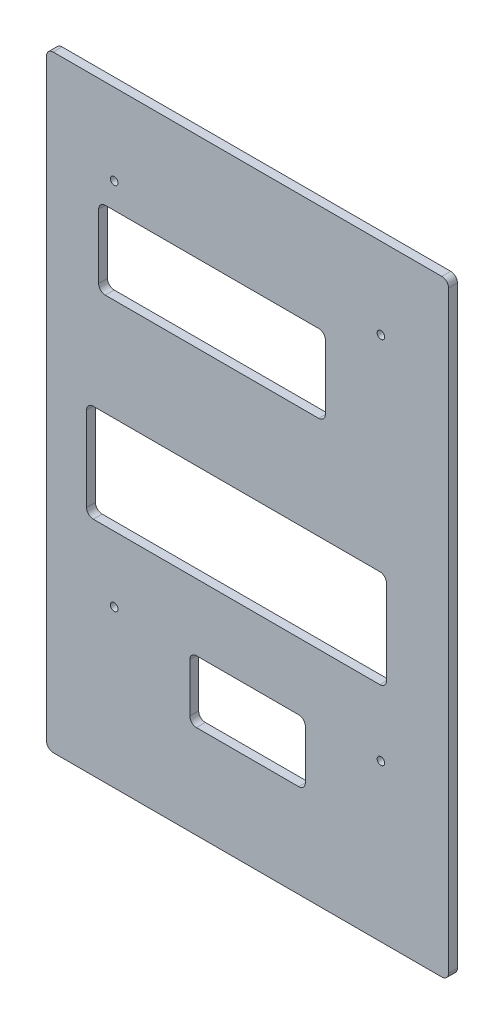
from build123d import *

# Parameters (mm, degrees)
ESQUISSE1_W             = 180.86
ESQUISSE1_H             = 273
ESQUISSE1_R             = 1.5
ESQUISSE1_W_2           = 52
ESQUISSE1_H_2           = 28
ESQUISSE1_W_3           = 134.93
ESQUISSE1_H_3           = 44
ESQUISSE1_W_4           = 102
ESQUISSE1_H_4           = 35
BOSS_EXTRU_1_DEPTH      = 4
D_GAGEMENT_M31_D        = 3.4
CONG_1_R                = 3
ESQUISSE5_R             = 2.37073369
ENL_V_MAT_EXTRU_2_DEPTH = 1


with BuildPart() as part:
    # Esquisse1 → Boss.-Extru.1 (new body)
    with BuildSketch(Plane.XY):
        with Locations((90.43, 136.5)):
            Rectangle(ESQUISSE1_W, ESQUISSE1_H)
        with Locations((30.43, 236.5)):
            Circle(ESQUISSE1_R, mode=Mode.SUBTRACT)
        with Locations((150.43, 236.5)):
            Circle(ESQUISSE1_R, mode=Mode.SUBTRACT)
        with Locations((30.43, 70.5)):
            Circle(ESQUISSE1_R, mode=Mode.SUBTRACT)
        with Locations((150.43, 70.5)):
            Circle(ESQUISSE1_R, mode=Mode.SUBTRACT)
        with Locations((90.43, 56)):
            Rectangle(ESQUISSE1_W_2, ESQUISSE1_H_2, mode=Mode.SUBTRACT)
        with Locations((85.465, 122)):
            Rectangle(ESQUISSE1_W_3, ESQUISSE1_H_3, mode=Mode.SUBTRACT)
        with Locations((74.43, 207.5)):
            Rectangle(ESQUISSE1_W_4, ESQUISSE1_H_4, mode=Mode.SUBTRACT)
    extrude(amount=BOSS_EXTRU_1_DEPTH)

    # Dégagement M31 (through all)
    with Locations(Plane.XY.offset(4)):
        with Locations((30.43, 236.5), (150.43, 236.5), (150.43, 70.5), (30.43, 70.5)):
            Hole(D_GAGEMENT_M31_D / 2)

    # Congé1
    cong_1_edges = [part.edges().sort_by_distance(p)[0] for p in [
        (0, 0, 2),
        (180.86, 0, 2),
        (116.43, 42, 2),
        (64.43, 42, 2),
        (116.43, 70, 2),
        (64.43, 70, 2),
        (152.93, 100, 2),
        (18, 100, 2),
        (152.93, 144, 2),
        (18, 144, 2),
        (180.86, 273, 2),
        (0, 273, 2),
        (125.43, 190, 2),
        (125.43, 225, 2),
        (23.43, 225, 2),
        (23.43, 190, 2),
    ]]
    fillet(cong_1_edges, radius=CONG_1_R)

    # Esquisse5 → Enlèv. mat.-Extru.2 (cut)
    # profile 1 of 11: a face of its own
    with BuildSketch(Plane(origin=(0, 0, 0), x_dir=(-1, 0, 0), z_dir=(0, 0, -1))):
        Polygon((-94.283346835, 174.034677194), (-91.185169292, 174.034677194), (-91.182359598, 166.790649968), (-88.077554099, 170.336852385), (-84.69677529, 170.336852385), (-88.331818801, 166.259366774), (-84.453541471, 160.018398975), (-87.922812939, 160.018398975), (-90.427752118, 164.343168722), (-91.182359598, 163.827233749), (-91.182359598, 160.018398975), (-94.283346835, 160.018398975), align=None)
    # profile 2 of 11: a face of its own
    with BuildSketch(Plane(origin=(0, 0, 0), x_dir=(-1, 0, 0), z_dir=(0, 0, -1))):
        with BuildLine():
            Line((-78.792459122, 174.034677194), (-75.689252185, 174.034677194))
            Line((-75.689252185, 174.034677194), (-75.689252185, 169.149539362))
            add(Edge.make_bspline(
                [(-75.689252185, 169.149539362), (-75.259442931, 169.759749882), (-73.910117231, 170.528137365), (-70.907930579, 170.723106308), (-69.542099901, 168.641576988), (-69.526370215, 167.438557264)],
                knots=[0, 0, 0, 0, 0.262740623, 0.558365338, 1, 1, 1, 1], degree=3))
            Line((-69.526370215, 167.438557264), (-69.526370215, 160.018398975))
            Line((-69.526370215, 160.018398975), (-72.624885356, 160.018398975))
            Line((-72.624885356, 160.018398975), (-72.624885356, 166.790649968))
            add(Edge.make_bspline(
                [(-75.694281579, 165.950650474), (-75.607046533, 166.608895098), (-75.198613544, 167.568039344), (-73.608769863, 168.496367369), (-72.525461974, 167.521061969), (-72.624885356, 166.790649968)],
                knots=[0, 0, 0, 0, 0.39454131, 0.596070008, 1, 1, 1, 1], degree=3))
            Line((-75.694281579, 165.950650474), (-75.694281579, 160.018398975))
            Line((-75.694281579, 160.018398975), (-78.792459122, 160.018398975))
            Line((-78.792459122, 160.018398975), (-78.792459122, 174.034677194))
        make_face()
    # profile 3 of 11: a face of its own
    with BuildSketch(Plane(origin=(0, 0, 0), x_dir=(-1, 0, 0), z_dir=(0, 0, -1))):
        with BuildLine():
            Line((-139.256891809, 172.935323872), (-137.158126377, 172.935323872))
            Line((-137.158126377, 172.935323872), (-137.158126377, 170.436793596))
            Line((-137.158126377, 170.436793596), (-133.673463028, 170.436793596))
            Line((-133.673463028, 170.436793596), (-133.673463028, 168.138145742))
            Line((-133.673463028, 168.138145742), (-137.158126377, 168.138145742))
            Line((-137.158126377, 168.138145742), (-137.158126377, 162.870364156))
            add(Edge.make_bspline(
                [(-137.158126377, 162.870364156), (-137.135735133, 162.620457218), (-136.829841883, 162.329297605), (-135.45963159, 161.948909237), (-134.22981955, 162.30663317), (-133.27943708, 162.541437923)],
                knots=[0, 0, 0, 0, 0.163675361, 0.277490049, 1, 1, 1, 1], degree=3))
            Line((-133.27943708, 162.541437923), (-133.27943708, 160.242790069))
            add(Edge.make_bspline(
                [(-133.27943708, 160.242790069), (-134.814099805, 160.050957228), (-138.701915147, 159.232331269), (-139.675674588, 161.34214339), (-139.808114513, 161.629096562), (-139.94978442, 161.926620231), (-139.975498221, 162.24161429), (-140.135507958, 164.201733563), (-140.072016369, 166.174224534), (-140.175380643, 168.138145742)],
                knots=[0, 0, 0, 0, 1, 1, 1, 2, 2, 2, 3, 3, 3, 3], degree=3))
            Line((-140.175380643, 168.138145742), (-141.753204023, 168.138145742))
            Line((-141.753204023, 168.138145742), (-141.753204023, 170.336852385))
            Line((-141.753204023, 170.336852385), (-140.023860949, 170.336852385))
            Line((-140.023860949, 170.336852385), (-139.256891809, 172.935323872))
        make_face()
    # profile 4 of 11: a face of its own
    with BuildSketch(Plane(origin=(0, 0, 0), x_dir=(-1, 0, 0), z_dir=(0, 0, -1))):
        with BuildLine():
            Line((-12.931201039, 172.935323872), (-10.932376817, 172.835382661))
            Line((-10.932376817, 172.835382661), (-10.832435606, 170.436793596))
            Line((-10.832435606, 170.436793596), (-7.434434431, 170.436793596))
            Line((-7.434434431, 170.436793596), (-7.434434431, 168.138145742))
            Line((-7.434434431, 168.138145742), (-10.932376817, 168.138145742))
            Line((-10.932376817, 168.138145742), (-10.832435606, 162.541437923))
            add(Edge.make_bspline(
                [(-7.034669586, 162.441496712), (-7.800572606, 162.237765999), (-9.055924893, 162.128236657), (-10.454489022, 162.072852708), (-10.832435606, 162.541437923)],
                knots=[0, 0, 0, 0, 0.590901675, 1, 1, 1, 1], degree=3))
            Line((-7.034669586, 162.441496712), (-7.034669586, 160.242790069))
            add(Edge.make_bspline(
                [(-7.034669586, 160.242790069), (-8.624443953, 160.067625406), (-12.469864417, 159.308373099), (-13.414156851, 161.435507228), (-13.623994546, 161.908192286), (-13.782004231, 162.4232356), (-13.791969329, 162.940307858), (-13.825996528, 164.705922314), (-13.806980244, 166.472160588), (-13.814485702, 168.238086953)],
                knots=[0, 0, 0, 0, 1, 1, 1, 2, 2, 2, 3, 3, 3, 3], degree=3))
            Line((-13.814485702, 168.238086953), (-15.440621885, 168.238086953))
            Line((-15.440621885, 168.238086953), (-15.440621885, 170.436793596))
            Line((-15.440621885, 170.436793596), (-13.716472945, 170.436793596))
            Line((-13.716472945, 170.436793596), (-12.931201039, 172.935323872))
        make_face()
    # profile 5 of 11: a face of its own
    with BuildSketch(Plane(origin=(0, 0, 0), x_dir=(-1, 0, 0), z_dir=(0, 0, -1))):
        Polygon((-174.236315677, 172.835382661), (-163.638100396, 172.835382661), (-163.638100396, 170.233513434), (-167.332675309, 170.233513434), (-167.332675309, 160.018398975), (-170.52219302, 160.018398975), (-170.570325513, 170.233513434), (-174.236315677, 170.233513434), align=None)
    # profile 6 of 11: a face of its own
    with BuildSketch(Plane(origin=(0, 0, 0), x_dir=(-1, 0, 0), z_dir=(0, 0, -1))):
        with BuildLine():
            Line((-47.213493181, 160.06614185), (-47.213493181, 172.835382661))
            Line((-47.213493181, 172.835382661), (-41.519185643, 172.835382661))
            add(Edge.make_bspline(
                [(-39.528607541, 166.790649968), (-38.956489083, 166.948005768), (-38.237437626, 167.683242131), (-37.896820407, 168.973263869), (-37.811326567, 170.127809871), (-38.284767117, 171.257641656), (-39.479973382, 172.391122107), (-40.692099064, 172.776713978), (-41.519185643, 172.835382661)],
                knots=[0, 0, 0, 0, 0.199158379, 0.317574937, 0.451003297, 0.584990763, 0.718220369, 1, 1, 1, 1], degree=3))
            add(Edge.make_bspline(
                [(-40.669958921, 160.06614185), (-39.736727743, 160.157652535), (-38.480391966, 160.846771809), (-37.259453131, 162.342559511), (-37.170137797, 163.667458124), (-37.174288807, 165.538002607), (-38.716644404, 166.479395874), (-39.528607541, 166.790649968)],
                knots=[0, 0, 0, 0, 0.282707491, 0.435580188, 0.571415841, 0.685536499, 1, 1, 1, 1], degree=3))
            Line((-40.669958921, 160.06614185), (-47.213493181, 160.06614185))
        make_face()
        with BuildLine():
            Line((-44.008657035, 167.93826332), (-44.008657035, 170.336852385))
            Line((-44.008657035, 170.336852385), (-42.174298778, 170.336852385))
            add(Edge.make_bspline(
                [(-42.049794824, 167.93826332), (-41.669827031, 167.927070476), (-41.248589309, 168.346380324), (-41.07437401, 169.11731054), (-41.21655482, 169.96394874), (-41.825514646, 170.299249739), (-42.174298778, 170.336852385)],
                knots=[0, 0, 0, 0, 0.294874779, 0.472371571, 0.685290478, 1, 1, 1, 1], degree=3))
            Line((-42.049794824, 167.93826332), (-44.008657035, 167.93826332))
        make_face(mode=Mode.SUBTRACT)
        with BuildLine():
            Line((-44.026733029, 165.464806319), (-44.026733029, 162.541437923))
            Line((-44.026733029, 162.541437923), (-41.810545792, 162.541437923))
            ThreePointArc((-41.810545792, 162.541437923), (-40.348861594, 164.003122121), (-41.810545792, 165.464806319))
            Line((-41.810545792, 165.464806319), (-44.026733029, 165.464806319))
        make_face(mode=Mode.SUBTRACT)
    # profile 7 of 11: a face of its own
    with BuildSketch(Plane(origin=(0, 0, 0), x_dir=(-1, 0, 0), z_dir=(0, 0, -1))):
        with BuildLine():
            Line((-27.522617852, 172.135794184), (-25.223969998, 172.035852973))
            Line((-25.223969998, 172.035852973), (-24.924146365, 170.636676018))
            add(Edge.make_bspline(
                [(-24.924146365, 170.636676018), (-23.547713892, 170.177865194), (-23.893594467, 170.424239717), (-22.825380933, 171.136382073)],
                knots=[0, 0, 0, 0, 1, 1, 1, 1], degree=3))
            Line((-22.825380933, 171.136382073), (-21.149702282, 169.437381485))
            Line((-21.149702282, 169.437381485), (-22.045562011, 168.238086953))
            Line((-22.045562011, 168.238086953), (-21.633263005, 167.328340687))
            Line((-21.633263005, 167.328340687), (-20.226909445, 167.138733631))
            Line((-20.226909445, 167.138733631), (-20.326850656, 164.840085777))
            Line((-20.326850656, 164.840085777), (-21.726027611, 164.540262144))
            add(Edge.make_bspline(
                [(-21.726027611, 164.540262144), (-22.206613971, 163.098503063), (-21.903336346, 163.59564387), (-21.326262767, 162.441496712)],
                knots=[0, 0, 0, 0, 1, 1, 1, 1], degree=3))
            Line((-21.326262767, 162.441496712), (-22.925322144, 160.842437335))
            Line((-22.925322144, 160.842437335), (-24.124616676, 161.641967023))
            Line((-24.124616676, 161.641967023), (-25.024087576, 161.242202179))
            Line((-25.024087576, 161.242202179), (-25.323911209, 159.843025224))
            Line((-25.323911209, 159.843025224), (-27.522617852, 159.942966435))
            Line((-27.522617852, 159.942966435), (-27.822441485, 161.34214339))
            add(Edge.make_bspline(
                [(-27.822441485, 161.34214339), (-28.799212683, 161.667733789), (-28.555204575, 161.758652056), (-29.22161844, 161.34214339), (-29.449377161, 161.19979419), (-29.688010758, 161.075633494), (-29.921206917, 160.942378546)],
                knots=[0, 0, 0, 0, 1, 1, 1, 2, 2, 2, 2], degree=3))
            Line((-29.921206917, 160.942378546), (-31.520266294, 162.541437923))
            Line((-31.520266294, 162.541437923), (-30.720736606, 163.740732455))
            Line((-30.720736606, 163.740732455), (-31.12050145, 164.640203355))
            Line((-31.12050145, 164.640203355), (-32.519678405, 164.940026988))
            Line((-32.519678405, 164.940026988), (-32.419737194, 167.138733631))
            Line((-32.419737194, 167.138733631), (-31.020560239, 167.438557264))
            Line((-31.020560239, 167.438557264), (-30.720736606, 168.338028164))
            Line((-30.720736606, 168.338028164), (-31.520266294, 169.537322696))
            Line((-31.520266294, 169.537322696), (-29.921206917, 171.036440862))
            add(Edge.make_bspline(
                [(-29.921206917, 171.036440862), (-29.494314144, 170.894143271), (-29.168603613, 170.386484744), (-28.721912385, 170.336852385), (-28.380115397, 170.298874942), (-28.120867147, 170.537200797), (-27.822441485, 170.636676018)],
                knots=[0, 0, 0, 0, 1, 1, 1, 2, 2, 2, 2], degree=3))
            Line((-27.822441485, 170.636676018), (-27.522617852, 172.135794184))
        make_face()
        with Locations((-26.386833531, 165.983241371)):
            Circle(ESQUISSE5_R, mode=Mode.SUBTRACT)
    # profile 8 of 11: a face of its own
    with BuildSketch(Plane(origin=(0, 0, 0), x_dir=(-1, 0, 0), z_dir=(0, 0, -1))):
        Polygon((-121.36741503, 171.73602934), (-113.272176935, 160.142848858), (-130.162241603, 160.242790069), align=None)
        Polygon((-122.8784515, 167.733423277), (-124.965298628, 161.242202179), (-127.96353496, 161.34214339), align=None, mode=Mode.SUBTRACT)
        Polygon((-121.267473819, 169.437381485), (-115.470883578, 161.34214339), (-123.666062884, 161.34214339), align=None, mode=Mode.SUBTRACT)
    # profile 9 of 11: a face of its own
    with BuildSketch(Plane(origin=(0, 0, 0), x_dir=(-1, 0, 0), z_dir=(0, 0, -1))):
        with BuildLine():
            Line((-101.1220469, 160.018398975), (-104.165968477, 160.018398975))
            Line((-104.165968477, 160.018398975), (-104.165968477, 165.950650474))
            add(Edge.make_bspline(
                [(-107.272446663, 165.950650474), (-107.246526147, 166.745002821), (-106.276228736, 168.588199152), (-104.043085613, 167.741682876), (-104.204058368, 166.455663269), (-104.165968477, 165.950650474)],
                knots=[0, 0, 0, 0, 0.496685, 0.694227188, 1, 1, 1, 1], degree=3))
            Line((-107.272446663, 165.950650474), (-107.272446663, 160.018398975))
            Line((-107.272446663, 160.018398975), (-110.373881815, 160.018398975))
            Line((-110.373881815, 160.018398975), (-110.373881815, 170.436793596))
            Line((-110.373881815, 170.436793596), (-107.470999641, 170.436793596))
            Line((-107.470999641, 170.436793596), (-107.470999641, 169.149539362))
            Line((-107.470999641, 169.149539362), (-107.272446663, 169.149539362))
            add(Edge.make_bspline(
                [(-107.272446663, 169.149539362), (-106.858538525, 169.829859962), (-105.517894499, 170.598013205), (-103.520232225, 170.635762217), (-101.657211683, 169.687420486), (-101.152134581, 168.286093678), (-101.1220469, 167.438557264)],
                knots=[0, 0, 0, 0, 0.278640188, 0.525252243, 0.687769466, 1, 1, 1, 1], degree=3))
            Line((-101.1220469, 167.438557264), (-101.1220469, 160.018398975))
        make_face()
    # profile 10 of 11: a face of its own
    with BuildSketch(Plane(origin=(0, 0, 0), x_dir=(-1, 0, 0), z_dir=(0, 0, -1))):
        with BuildLine():
            Line((-55.536124826, 159.942966435), (-54.05995465, 159.942966435))
            add(Edge.make_bspline(
                [(-54.05995465, 159.942966435), (-53.508105979, 160.01579836), (-53.000836715, 160.242790069)],
                knots=[0, 0, 0, 1, 1, 1], degree=2))
            Line((-53.000836715, 160.242790069), (-53.000836715, 162.127229521))
            add(Edge.make_bspline(
                [(-54.414465889, 162.65067545), (-54.397822189, 162.444945707), (-54.131217592, 161.731860695), (-53.322133646, 162.037641941), (-53.000836715, 162.127229521)],
                knots=[0, 0, 0, 0, 0.373122237, 1, 1, 1, 1], degree=3))
            Line((-54.414465889, 162.65067545), (-54.414465889, 167.006083276))
            add(Edge.make_bspline(
                [(-54.414465889, 167.006083276), (-54.386504145, 167.621449135), (-54.651940285, 168.602619281), (-55.530786964, 169.638124659), (-56.720166972, 170.506789896), (-57.883902376, 170.537080698), (-58.570212672, 170.576762938)],
                knots=[0, 0, 0, 0, 0.300061028, 0.469139707, 0.655769187, 1, 1, 1, 1], degree=3))
            add(Edge.make_bspline(
                [(-62.909353069, 167.1387297), (-62.863627032, 167.85106608), (-62.159984886, 169.942717077), (-59.815362212, 170.602349771), (-58.570212672, 170.576762938)],
                knots=[0, 0, 0, 0, 0.353066215, 1, 1, 1, 1], degree=3))
            Line((-62.909353069, 167.1387297), (-59.710062437, 167.03879242))
            add(Edge.make_bspline(
                [(-59.710062437, 167.03879242), (-59.772976556, 167.453131763), (-59.351848428, 168.878548654), (-57.474509929, 168.363912338), (-57.481549229, 167.328340687)],
                knots=[0, 0, 0, 0, 0.367002115, 1, 1, 1, 1], degree=3))
            Line((-57.481549229, 167.328340687), (-57.481549229, 166.539441837))
            add(Edge.make_bspline(
                [(-57.086432706, 161.34214339), (-57.377446818, 161.051649381), (-57.819055658, 160.557721707), (-58.186679465, 160.343714944), (-59.360706767, 159.660272315), (-61.06795204, 159.627086373), (-62.184236921, 160.447231624), (-63.701766095, 161.562174922), (-63.671428161, 164.622806523), (-62.079647588, 165.644083132), (-60.725568887, 166.512851686), (-59.002445589, 166.423818059), (-57.481549229, 166.539441837)],
                knots=[0, 0, 0, 0, 1, 1, 1, 2, 2, 2, 3, 3, 3, 4, 4, 4, 4], degree=3))
            add(Edge.make_bspline(
                [(-57.086432706, 161.34214339), (-56.941883806, 160.602544997), (-56.244905873, 160.079915331), (-55.536124826, 159.942966435)],
                knots=[0, 0, 0, 0, 1, 1, 1, 1], degree=3))
        make_face()
        with BuildLine():
            Line((-57.504981168, 164.540262144), (-59.142188105, 164.540262144))
            ThreePointArc((-59.142188105, 164.540262144), (-59.761878777, 164.313650273), (-60.089193064, 163.740732455))
            Line((-60.089193064, 163.740732455), (-60.089193064, 162.870364156))
            add(Edge.make_bspline(
                [(-57.504981168, 163.827233749), (-57.530560699, 163.319345142), (-57.998402486, 162.551066292), (-59.183910763, 162.12566475), (-60.062059738, 162.268391521), (-60.089193064, 162.870364156)],
                knots=[0, 0, 0, 0, 0.406446969, 0.637071772, 1, 1, 1, 1], degree=3))
            Line((-57.504981168, 163.827233749), (-57.504981168, 164.540262144))
        make_face(mode=Mode.SUBTRACT)
    # profile 11 of 11: a face of its own
    with BuildSketch(Plane(origin=(0, 0, 0), x_dir=(-1, 0, 0), z_dir=(0, 0, -1))):
        with BuildLine():
            Line((-157.743373817, 170.336852385), (-154.691660567, 170.35202095))
            Line((-154.691660567, 170.35202095), (-154.691660567, 164.305357131))
            add(Edge.make_bspline(
                [(-154.691660567, 164.305357131), (-154.739400236, 163.733239021), (-154.544395693, 163.005941624), (-153.763344575, 162.177589551), (-152.873479584, 162.373329578), (-152.034409307, 163.044126987), (-151.856832613, 163.856575061), (-151.804866228, 164.305357131)],
                knots=[0, 0, 0, 0, 0.303186939, 0.415254368, 0.583999264, 0.737935454, 1, 1, 1, 1], degree=3))
            Line((-151.804866228, 164.305357131), (-151.804866228, 170.35202095))
            Line((-151.804866228, 170.35202095), (-148.751306859, 170.336852385))
            Line((-148.751306859, 170.336852385), (-148.647259476, 160.018398975))
            Line((-148.647259476, 160.018398975), (-151.62161785, 160.018398975))
            Line((-151.62161785, 160.018398975), (-151.62161785, 161.426937785))
            add(Edge.make_bspline(
                [(-151.62161785, 161.426937785), (-151.917216442, 161.122947828), (-152.172795278, 160.774098664), (-152.508413627, 160.514967913), (-152.744262162, 160.332869384), (-153.020940607, 160.202225705), (-153.302270784, 160.104053727), (-155.63936652, 159.28850911), (-157.550929713, 160.797221628), (-157.644076002, 163.241721213), (-157.734138136, 165.60528128), (-157.710274545, 167.971808661), (-157.743373817, 170.336852385)],
                knots=[0, 0, 0, 0, 1, 1, 1, 2, 2, 2, 3, 3, 3, 4, 4, 4, 4], degree=3))
        make_face()
    extrude(amount=-ENL_V_MAT_EXTRU_2_DEPTH, mode=Mode.SUBTRACT)


solid = part.part
